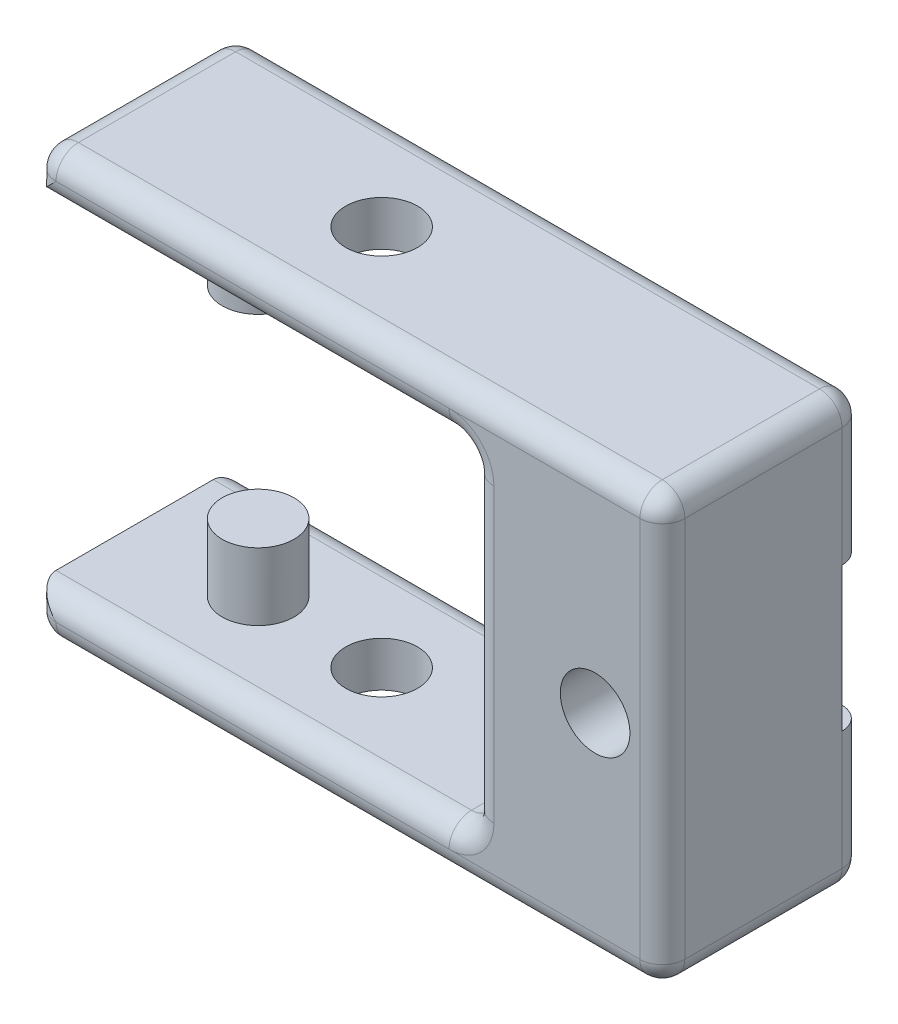
from build123d import *

# Parameters (mm, degrees)
SKETCH1_W      = 28
SKETCH1_H      = 9
EXTRUDE1_DEPTH = 19
SKETCH2_R      = 1.6
EXTRUDE2_DEPTH = 26.621437653
SKETCH3_W      = 19.5
SKETCH3_H      = 15
EXTRUDE3_DEPTH = 27.643580689
SKETCH6_R      = 1.6
EXTRUDE4_DEPTH = 3
EXTRUDE5_START = 3
SKETCH7_R      = 1.6
EXTRUDE5_DEPTH = 3
SKETCH8_W      = 6.6
SKETCH8_H      = 6.4
EXTRUDE6_DEPTH = 1
SKETCH9_R      = 1.55
EXTRUDE7_DEPTH = 27.322621297
FILLET1_R      = 1


with BuildPart() as part:
    # Sketch1 → Extrude1 (new body)
    with BuildSketch(Plane(origin=(0, 0, 0), x_dir=(1, 0, 0), z_dir=(0, 1, 0))):
        with Locations((2.367052023, 0.751445087)):
            Rectangle(SKETCH1_W, SKETCH1_H)
    extrude(amount=EXTRUDE1_DEPTH)

    # Sketch2 → Extrude2 (cut, through all)
    with BuildSketch(Plane(origin=(0, 19, 0), x_dir=(1, 0, 0), z_dir=(0, 1, 0))):
        with Locations(Location((-0.632947977, 0.751445087, 0), (0, 0, 270))):
            Circle(SKETCH2_R)
    extrude(amount=-EXTRUDE2_DEPTH, mode=Mode.SUBTRACT)

    # Sketch3 → Extrude3 (cut, through all)
    with BuildSketch(Plane.XY.offset(3.748554913)):
        with Locations((-1.882947977, 9.5)):
            Rectangle(SKETCH3_W, SKETCH3_H)
    extrude(amount=-EXTRUDE3_DEPTH, mode=Mode.SUBTRACT)

    # Sketch6 → Extrude4 (add)
    with BuildSketch(Plane(origin=(0, 2, 0), x_dir=(1, 0, 0), z_dir=(0, 1, 0))):
        with Locations(Location((-6.132947977, 0.751445087, 0), (0, 0, 90))):
            Circle(SKETCH6_R)
    extrude(amount=EXTRUDE4_DEPTH)

    # Sketch7 → Extrude5 (add)
    with BuildSketch(Plane.XZ.offset(-17).offset(EXTRUDE5_START)):
        with Locations(Location((-6.132947977, -0.751445087, 0), (0, 0, 270))):
            Circle(SKETCH7_R)
    extrude(amount=-EXTRUDE5_DEPTH)

    # Sketch8 → Extrude6 (cut)
    with BuildSketch(Plane(origin=(0, 0, -5.251445087), x_dir=(-1, 0, 0), z_dir=(0, 0, -1))):
        with Locations((-13.067052023, 9.5)):
            Rectangle(SKETCH8_W, SKETCH8_H)
    extrude(amount=-EXTRUDE6_DEPTH, mode=Mode.SUBTRACT)

    # Sketch9 → Extrude7 (cut, through all)
    with BuildSketch(Plane(origin=(0, 0, -4.251445087), x_dir=(-1, 0, 0), z_dir=(0, 0, -1))):
        with Locations((-13.373052023, 9.5)):
            Circle(SKETCH9_R)
    extrude(amount=-EXTRUDE7_DEPTH, mode=Mode.SUBTRACT)

    # Fillet1
    fillet1_edges = [part.edges().sort_by_distance(p)[0] for p in [
        (2.367052023, 19, -5.251445087),
        (2.367052023, 0, 3.748554913),
        (2.367052023, 0, -5.251445087),
        (16.367052023, 0, -0.751445087),
        (16.367052023, 3.15, -5.251445087),
        (16.367052023, 9.5, 3.748554913),
        (-11.632947977, 0, -0.751445087),
        (-1.882947977, 2, 3.748554913),
        (-1.882947977, 2, -5.251445087),
        (7.867052023, 2, -0.751445087),
        (7.867052023, 17, -0.751445087),
        (7.867052023, 9.5, -5.251445087),
        (-1.882947977, 17, -5.251445087),
        (-11.632947977, 19, -0.751445087),
        (7.867052023, 9.5, 3.748554913),
        (-1.882947977, 17, 3.748554913),
        (2.367052023, 19, 3.748554913),
        (16.367052023, 19, -0.751445087),
        (16.367052023, 15.85, -5.251445087),
        (-11.632947977, 1, -5.251445087),
        (-11.632947977, 1, 3.748554913),
        (-11.632947977, 18, -5.251445087),
        (-11.632947977, 18, 3.748554913),
    ]]
    fillet(fillet1_edges, radius=FILLET1_R - 0.0001)  # a hair under: the kernel refuses the full size


solid = part.part
